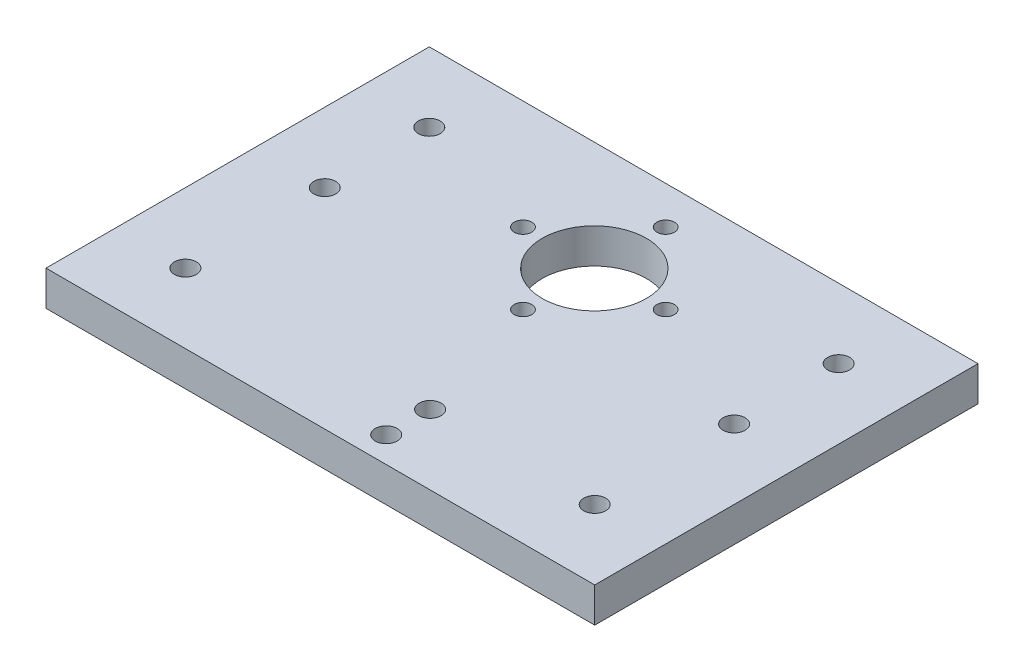
from build123d import *

# Parameters (mm, degrees)
SKETCH1_W                                       = 100
SKETCH1_H                                       = 69.85
SKETCH1_R                                       = 2
SKETCH1_R_2                                     = 9.5
BOSS_EXTRUDE1_DEPTH                             = 6.35
CSK_FOR_M3_FLAT_HEAD_MACHINE_SCREW1_D           = 3.2
CSK_FOR_M3_FLAT_HEAD_MACHINE_SCREW1_CSINK_D     = 6.3
CSK_FOR_M3_FLAT_HEAD_MACHINE_SCREW1_CSINK_ANGLE = 90


with BuildPart() as part:
    # Sketch1 → Boss-Extrude1 (new body)
    with BuildSketch(Plane(origin=(0, 0, 0), x_dir=(1, 0, 0), z_dir=(0, 1, 0))):
        Rectangle(SKETCH1_W, SKETCH1_H)
        with Locations((-37.3, 22.225)):
            Circle(SKETCH1_R, mode=Mode.SUBTRACT)
        with Locations((37.3, 22.225)):
            Circle(SKETCH1_R, mode=Mode.SUBTRACT)
        with Locations((37.3, -22.225)):
            Circle(SKETCH1_R, mode=Mode.SUBTRACT)
        with Locations((-37.3, -22.225)):
            Circle(SKETCH1_R, mode=Mode.SUBTRACT)
        with Locations((7.3, -30.225)):
            Circle(SKETCH1_R, mode=Mode.SUBTRACT)
        with Locations((7.3, -22.225)):
            Circle(SKETCH1_R, mode=Mode.SUBTRACT)
        with Locations((0, 15)):
            Circle(SKETCH1_R_2, mode=Mode.SUBTRACT)
        with Locations((-37.3, 3.175)):
            Circle(SKETCH1_R, mode=Mode.SUBTRACT)
        with Locations((37.3, 3.175)):
            Circle(SKETCH1_R, mode=Mode.SUBTRACT)
    extrude(amount=BOSS_EXTRUDE1_DEPTH)

    # CSK for M3 Flat Head Machine Screw1 (through all)
    with Locations(Plane(origin=(0, 0, 0), x_dir=(-1, 0, 0), z_dir=(0, -1, 0))):
        with Locations((-13, 15), (0, 2), (13, 15), (0, 28)):
            CounterSinkHole(CSK_FOR_M3_FLAT_HEAD_MACHINE_SCREW1_D / 2, CSK_FOR_M3_FLAT_HEAD_MACHINE_SCREW1_CSINK_D / 2, counter_sink_angle=CSK_FOR_M3_FLAT_HEAD_MACHINE_SCREW1_CSINK_ANGLE)


solid = part.part
